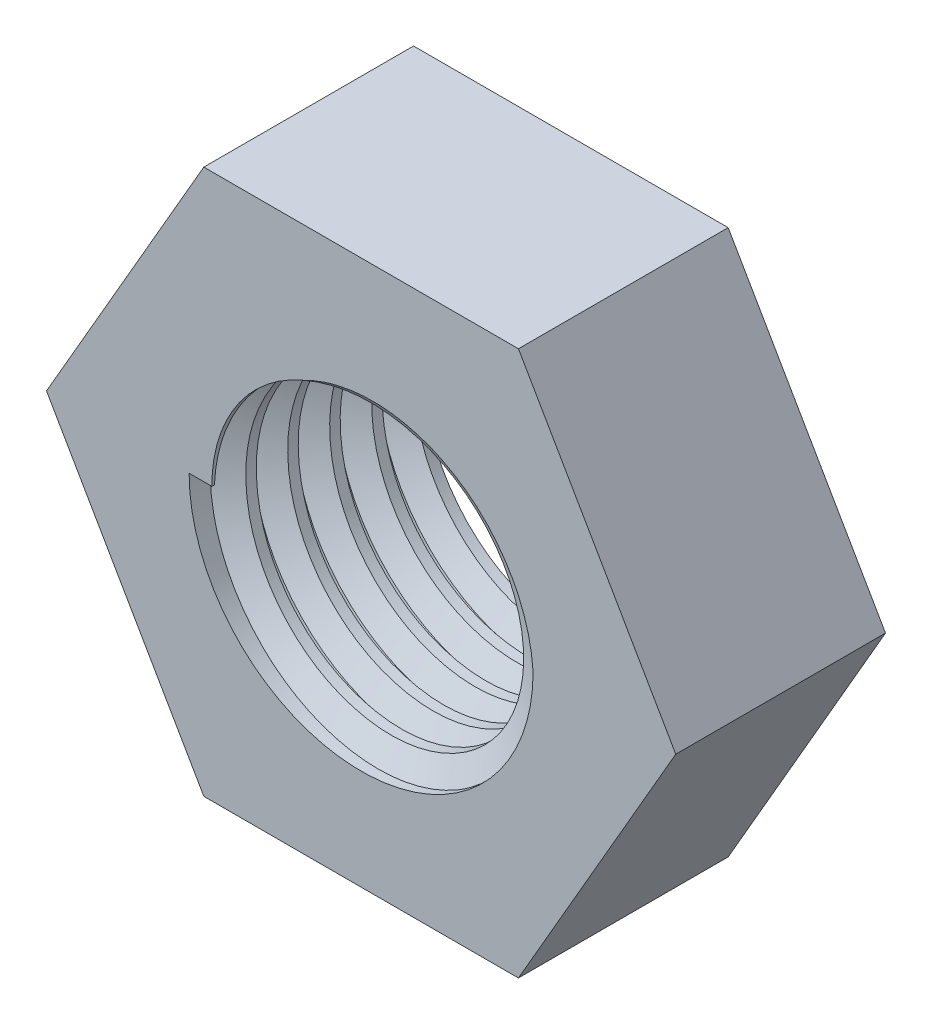
from build123d import *

# Parameters (mm, degrees)
CROQUIS1_R              = 15
CROQUIS1_R_2            = 8.2
SALIENTE_EXTRUIR1_DEPTH = 10
ROSCA1_PITCH            = 2
CROQUIS4_W              = 34.888845464
CROQUIS4_H              = 15.19564233
CROQUIS4_W_2            = 30
CROQUIS4_H_2            = 10
CORTAR_EXTRUIR1_DEPTH   = 17
CROQUIS5_W              = 38.82132153
CROQUIS5_H              = 16.048406572
CROQUIS5_W_2            = 30
CROQUIS5_H_2            = 10
CORTAR_EXTRUIR2_DEPTH   = 17
CROQUIS6_R              = 16.81382074
CORTAR_EXTRUIR3_DEPTH   = 17


with BuildPart() as part:
    # Croquis1 → Saliente-Extruir1 (new body)
    with BuildSketch(Plane.XY):
        Circle(CROQUIS1_R)
        Circle(CROQUIS1_R_2, mode=Mode.SUBTRACT)
    extrude(amount=SALIENTE_EXTRUIR1_DEPTH)

    # Rosca1: the profile of Perfil de rosca1 profile screwed along a right-hand helix of 5 turns, 10 arcs to a turn; built about Z, then put on its axis
    rosca1_z = Axis((0, 0, 0), (0, 0, 1))
    rosca1_corners = [(8.2003, 0, -0.000173205), (8.2003, 0, 1.7501732), (7.11746825, 0, 1.124999997), (7.11746825, 0, 0.624999997)]
    with BuildLine(mode=Mode.PRIVATE) as rosca1_profile:
        Line(rosca1_corners[0], rosca1_corners[1])
        Line(rosca1_corners[1], rosca1_corners[2])
        Line(rosca1_corners[2], rosca1_corners[3])
        Line(rosca1_corners[3], rosca1_corners[0])
    rosca1_cap = Face(rosca1_profile.wire())
    rosca1_turn_angles = [0, 18, 36, 54, 72, 90, 108, 126, 144, 162, 180, 198, 216, 234, 252, 270, 288, 306, 324, 342, 360]
    rosca1_turn_weights = [1, 0.9510565162951535, 1, 0.9510565162951535, 1, 0.9510565162951535, 1, 0.9510565162951535, 1, 0.9510565162951535, 1, 0.9510565162951535, 1, 0.9510565162951535, 1, 0.9510565162951535, 1, 0.9510565162951535, 1, 0.9510565162951535, 1]
    rosca1_turn_rails = [Edge.make_bspline([Vector(p[0], p[1], 0).rotate(rosca1_z, rosca1_turn_angles[k]) / rosca1_turn_weights[k] + Vector(0, 0, p[2] + ROSCA1_PITCH * rosca1_turn_angles[k] / 360) for k in range(21)], [0, 0, 0, 1, 1, 2, 2, 3, 3, 4, 4, 5, 5, 6, 6, 7, 7, 8, 8, 9, 9, 10, 10, 10], 2, rosca1_turn_weights) for p in rosca1_corners]
    rosca1_turn_sides = [Face.make_surface_from_curves(rosca1_turn_rails[p[0]], rosca1_turn_rails[p[1]]) for p in [(0, 1), (1, 2), (2, 3), (3, 0)]]
    rosca1 = Plane(origin=(0, 0, 11), x_dir=(-1, 0, 0), z_dir=(0, 0, -1)) * Solid(Shell([*[p.moved(Location((0, 0, ROSCA1_PITCH * i))) for i in range(5) for p in rosca1_turn_sides], rosca1_cap, rosca1_cap.rotate(rosca1_z, 1800).moved(Location((0, 0, ROSCA1_PITCH * 1800 / 360)))]))
    add(rosca1)

    # Croquis4 → Cortar-Extruir1 (cut)
    with BuildSketch(Plane(origin=(0, 0, 0), x_dir=(1, 0, 0), z_dir=(0, 1, 0))):
        with Locations((-0.545820486, -4.627845156)):
            Rectangle(CROQUIS4_W, CROQUIS4_H)
        with Locations((0, -5)):
            Rectangle(CROQUIS4_W_2, CROQUIS4_H_2, mode=Mode.SUBTRACT)
    extrude(amount=-CORTAR_EXTRUIR1_DEPTH, mode=Mode.SUBTRACT)

    # Croquis5 → Cortar-Extruir2 (cut)
    with BuildSketch(Plane(origin=(0, 0, 0), x_dir=(1, 0, 0), z_dir=(0, 1, 0))):
        with Locations((0.330060859, -4.229813115)):
            Rectangle(CROQUIS5_W, CROQUIS5_H)
        with Locations((0, -5)):
            Rectangle(CROQUIS5_W_2, CROQUIS5_H_2, mode=Mode.SUBTRACT)
    extrude(amount=CORTAR_EXTRUIR2_DEPTH, mode=Mode.SUBTRACT)

    # Croquis6 → Cortar-Extruir3 (cut)
    with BuildSketch(Plane.XY.offset(10)):
        Circle(CROQUIS6_R)
        Polygon((-15, 0), (-7.5, -12.990381057), (7.5, -12.990381057), (15, 0), (7.5, 12.990381057), (-7.5, 12.990381057), align=None, mode=Mode.SUBTRACT)
    extrude(amount=-CORTAR_EXTRUIR3_DEPTH, mode=Mode.SUBTRACT)


solid = part.part
